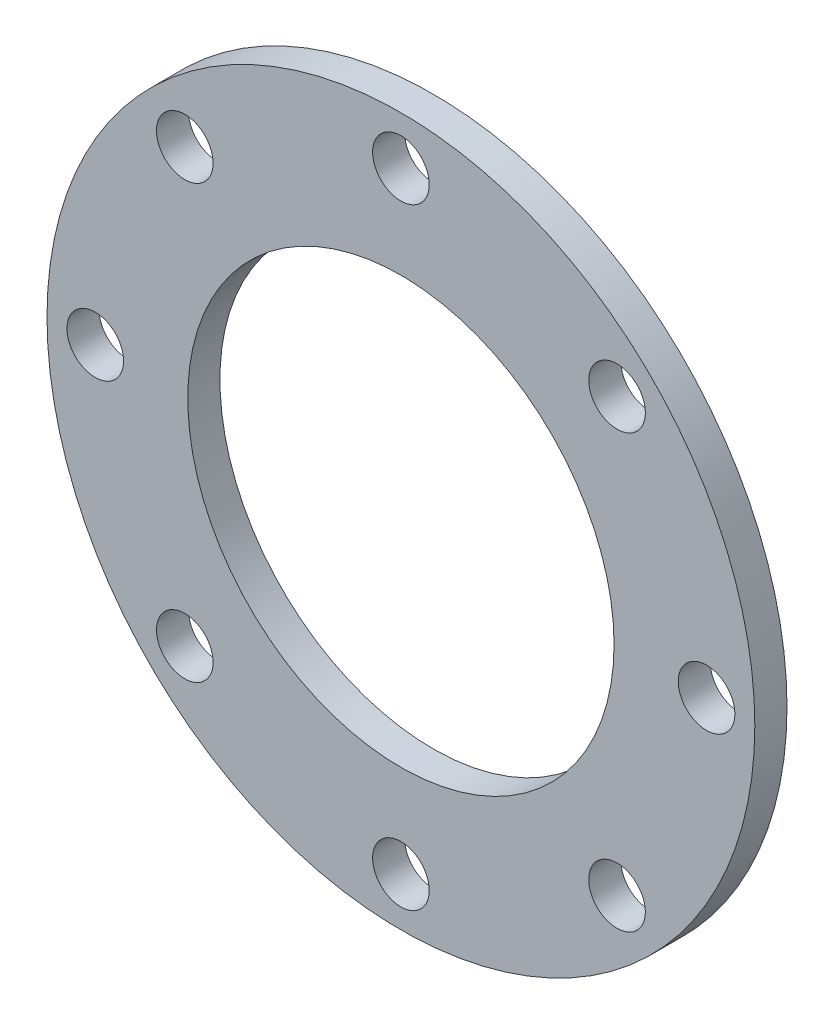
from build123d import *

# Parameters (mm, degrees)
SKETCH1_R           = 139.7
SKETCH1_R_2         = 84.1375
SKETCH1_R_3         = 11.176
BOSS_EXTRUDE1_DEPTH = 12.7


with BuildPart() as part:
    # Sketch1 → Boss-Extrude1 (new body)
    with BuildSketch(Plane.XY):
        Circle(SKETCH1_R)
        Circle(SKETCH1_R_2, mode=Mode.SUBTRACT)
        with Locations((0, 120.65)):
            Circle(SKETCH1_R_3, mode=Mode.SUBTRACT)
        with Locations((85.31243315, 85.31243315)):
            Circle(SKETCH1_R_3, mode=Mode.SUBTRACT)
        with Locations((120.65, 0)):
            Circle(SKETCH1_R_3, mode=Mode.SUBTRACT)
        with Locations((85.31243315, -85.31243315)):
            Circle(SKETCH1_R_3, mode=Mode.SUBTRACT)
        with Locations((0, -120.65)):
            Circle(SKETCH1_R_3, mode=Mode.SUBTRACT)
        with Locations((-85.31243315, -85.31243315)):
            Circle(SKETCH1_R_3, mode=Mode.SUBTRACT)
        with Locations((-120.65, 0)):
            Circle(SKETCH1_R_3, mode=Mode.SUBTRACT)
        with Locations((-85.31243315, 85.31243315)):
            Circle(SKETCH1_R_3, mode=Mode.SUBTRACT)
    extrude(amount=BOSS_EXTRUDE1_DEPTH)


solid = part.part
